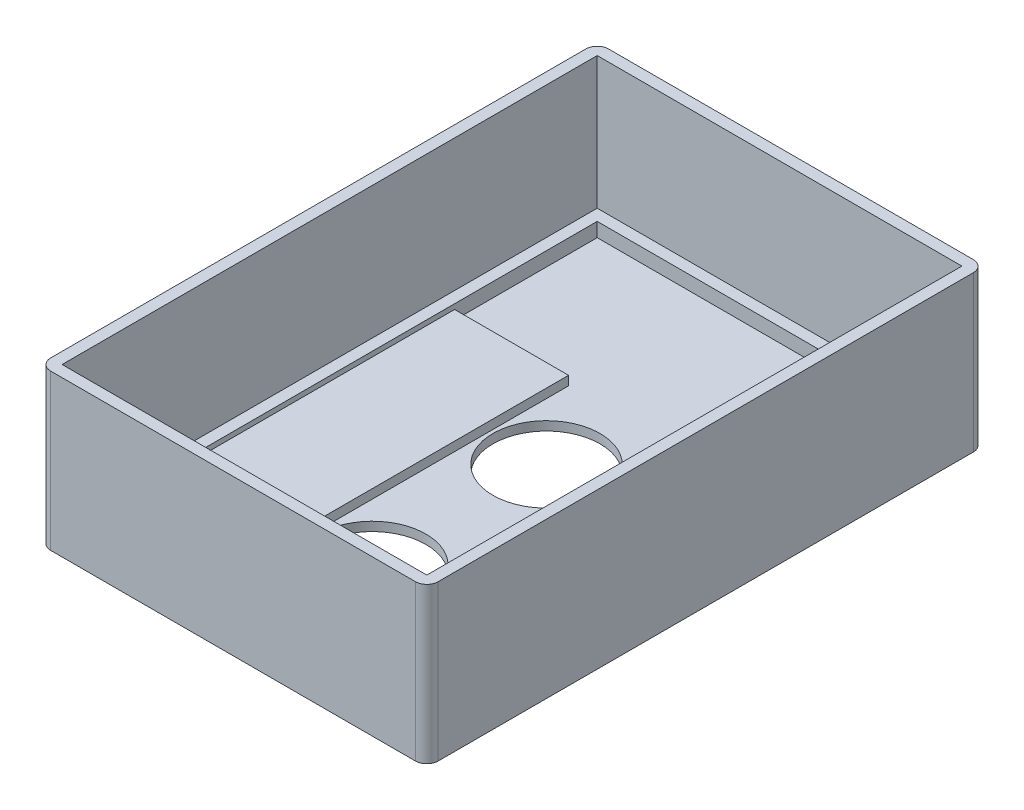
from build123d import *

# Parameters (mm, degrees)
SKETCH1_W           = 86.36
SKETCH1_H           = 124.333
BOSS_EXTRUDE1_DEPTH = 34.6202
SKETCH3_W           = 76.2
SKETCH3_H           = 114.173
CUT_EXTRUDE1_DEPTH  = 30.5816
SKETCH4_W           = 81.28
SKETCH4_H           = 119.253
CUT_EXTRUDE2_DEPTH  = 29.464
CUT_EXTRUDE3_DEPTH  = 2.032
SKETCH8_R           = 11.938
CUT_EXTRUDE4_DEPTH  = 2.032
FILLET1_R           = 2.54


with BuildPart() as part:
    # Sketch1 → Boss-Extrude1 (new body)
    with BuildSketch(Plane(origin=(0, 0, 0), x_dir=(1, 0, 0), z_dir=(0, 1, 0))):
        with Locations((43.18, 62.1665)):
            Rectangle(SKETCH1_W, SKETCH1_H)
    extrude(amount=BOSS_EXTRUDE1_DEPTH)

    # Sketch3 → Cut-Extrude1 (cut)
    with BuildSketch(Plane(origin=(0, 34.6202, 0), x_dir=(1, 0, 0), z_dir=(0, 1, 0))):
        with Locations((43.18, 62.1665)):
            Rectangle(SKETCH3_W, SKETCH3_H)
    extrude(amount=-CUT_EXTRUDE1_DEPTH, mode=Mode.SUBTRACT)

    # Sketch4 → Cut-Extrude2 (cut)
    with BuildSketch(Plane(origin=(0, 34.6202, 0), x_dir=(1, 0, 0), z_dir=(0, 1, 0))):
        with Locations((43.18, 62.1665)):
            Rectangle(SKETCH4_W, SKETCH4_H)
    extrude(amount=-CUT_EXTRUDE2_DEPTH, mode=Mode.SUBTRACT)

    # Sketch6 → Cut-Extrude3 (cut)
    with BuildSketch(Plane(origin=(0, 4.0386, 0), x_dir=(1, 0, 0), z_dir=(0, 1, 0))):
        Polygon((5.08, 119.253), (81.28, 119.253), (81.28, 87.471955448), (55.88, 87.471955448), (55.88, 5.08), (30.48, 5.08), (30.48, 87.471955448), (5.08, 87.471955448), align=None)
    extrude(amount=-CUT_EXTRUDE3_DEPTH, mode=Mode.SUBTRACT)

    # Sketch8 → Cut-Extrude4 (cut)
    with BuildSketch(Plane(origin=(0, 2.0066, 0), x_dir=(1, 0, 0), z_dir=(0, 1, 0))):
        with Locations((43.18, 31.0388)):
            Circle(SKETCH8_R)
        with Locations((43.18, 69.85)):
            Circle(SKETCH8_R)
    extrude(amount=-CUT_EXTRUDE4_DEPTH, mode=Mode.SUBTRACT)

    # Fillet1
    fillet1_edges = [part.edges().sort_by_distance(p)[0] for p in [
        (86.36, 17.3101, 0),
        (0, 17.3101, 0),
        (0, 17.3101, -124.333),
        (86.36, 17.3101, -124.333),
    ]]
    fillet(fillet1_edges, radius=FILLET1_R)


solid = part.part
